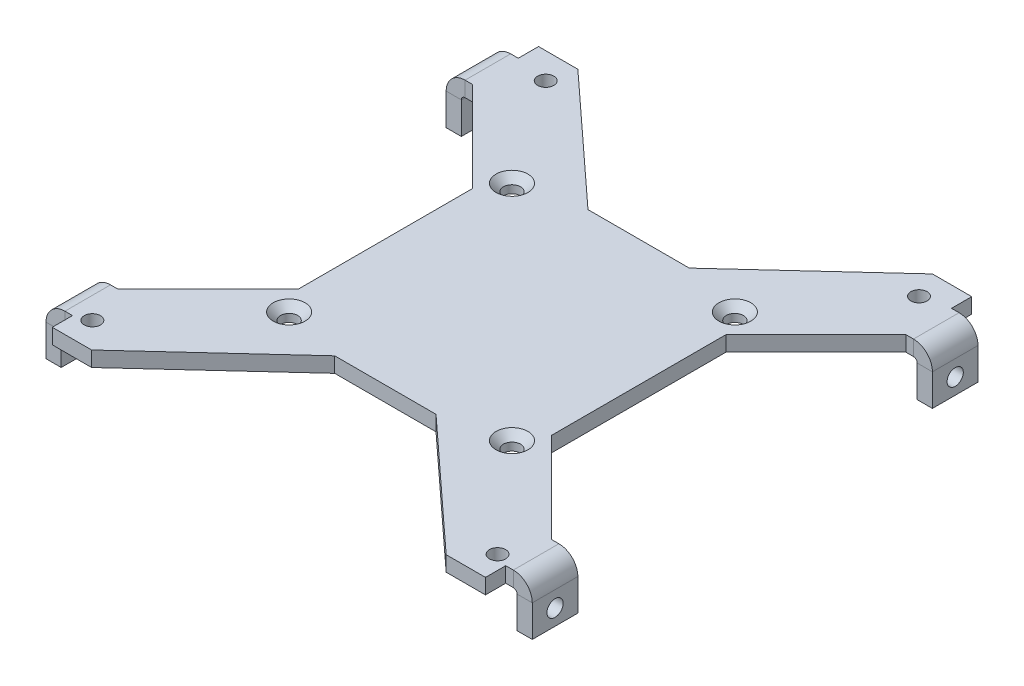
from build123d import *

# Parameters (mm, degrees)
SKETCH1_R                                       = 1.6
BASE_FLANGE1_DEPTH                              = 3
EDGE_FLANGE1_START                              = -44
EDGE_FLANGE1_DEPTH                              = 10.5
EDGE_FLANGE1_START_2                            = 33.5
EDGE_FLANGE1_2_DEPTH                            = 10.5
EDGE_FLANGE1_START_3                            = -35
EDGE_FLANGE1_3_DEPTH                            = 1.5
EDGE_FLANGE1_4_DEPTH                            = 1.5
EDGE_FLANGE1_START_4                            = -45.5
EDGE_FLANGE1_5_OUTLINE_W                        = 1.2366
EDGE_FLANGE1_5_OUTLINE_H                        = 3
EDGE_FLANGE1_5_DEPTH                            = 1.5
EDGE_FLANGE1_START_5                            = 44
EDGE_FLANGE1_6_OUTLINE_W                        = 1.2366
EDGE_FLANGE1_6_OUTLINE_H                        = 3
EDGE_FLANGE1_6_DEPTH                            = 1.5
EDGE_FLANGE1_7_DEPTH                            = 9
EDGE_FLANGE1_START_6                            = 35
EDGE_FLANGE1_8_DEPTH                            = 9
CUT_EXTRUDE2_DEPTH                              = 108.796103826
CUT_EXTRUDE2_DEPTH_BACK                         = 108.796103826
SKETCH27_R                                      = 1.6
SKETCH29_R                                      = 1.6
CUT_EXTRUDE4_DEPTH                              = 69.614867194
SKETCH40_W                                      = 1.2366
SKETCH40_H                                      = 2.5
CUT_EXTRUDE5_DEPTH                              = 69.614867194
CSK_FOR_M3_FLAT_HEAD_MACHINE_SCREW1_D           = 3.4
CSK_FOR_M3_FLAT_HEAD_MACHINE_SCREW1_CSINK_D     = 6.3
CSK_FOR_M3_FLAT_HEAD_MACHINE_SCREW1_CSINK_ANGLE = 90


# Read off the part's stored shape, not the designer's step: Edge-Flange1
# Sheet-metal steps are written as plain solids
with BuildPart() as part:
    # Sketch1 → Base-Flange1 (new body)
    with BuildSketch(Plane(origin=(0, 0, 0), x_dir=(1, 0, 0), z_dir=(0, 1, 0))):
        Polygon((-10, 25), (-35, 48), (-44, 48), (-44, 44), (-48, 44), (-48, 35), (-25, 10), (-25, -10), (-48, -35), (-48, -44), (-44, -44), (-44, -48), (-35, -48), (-10, -25), (10, -25), (35, -48), (44, -48), (44, -44), (48, -44), (48, -35), (25, -10), (25, 10), (48, 35), (48, 44), (44, 44), (44, 48), (35, 48), (10, 25), align=None)
        with Locations(Location((-22.000213283, 22.000213283, 0), (0, 0, 270))):
            Circle(SKETCH1_R, mode=Mode.SUBTRACT)
        with Locations(Location((22.000213283, 22.000213283, 0), (0, 0, 270))):
            Circle(SKETCH1_R, mode=Mode.SUBTRACT)
        with Locations(Location((22.000213283, -22.000213283, 0), (0, 0, 270))):
            Circle(SKETCH1_R, mode=Mode.SUBTRACT)
        with Locations(Location((-22.000213283, -22.000213283, 0), (0, 0, 270))):
            Circle(SKETCH1_R, mode=Mode.SUBTRACT)
    extrude(amount=-BASE_FLANGE1_DEPTH)

    # Edge-Flange1 outline → Edge-Flange1 (cut)
    with BuildSketch(Plane.XY.offset(EDGE_FLANGE1_START)):
        with BuildLine():
            ThreePointArc((-47.926677222, -3), (-46.630867001, -0.845704021), (-44.2634, 0))
            Line((-44.2634, 0), (-48, 0))
            Line((-48, 0), (-48, -3))
            Line((-48, -3), (-47.926677222, -3))
        make_face()
        with BuildLine():
            Line((48, 0), (44.2634, 0))
            ThreePointArc((44.2634, 0), (46.630867001, -0.845704021), (47.926677222, -3))
            Line((47.926677222, -3), (48, -3))
            Line((48, -3), (48, 0))
        make_face()
    extrude(amount=EDGE_FLANGE1_DEPTH, mode=Mode.SUBTRACT)

    # Edge-Flange1 2 outline → Edge-Flange1 2 (cut)
    with BuildSketch(Plane.XY.offset(EDGE_FLANGE1_START_2)):
        with BuildLine():
            ThreePointArc((-47.926677222, -3), (-46.630867001, -0.845704021), (-44.2634, 0))
            Line((-44.2634, 0), (-48, 0))
            Line((-48, 0), (-48, -3))
            Line((-48, -3), (-47.926677222, -3))
        make_face()
        with BuildLine():
            Line((48, 0), (44.2634, 0))
            ThreePointArc((44.2634, 0), (46.630867001, -0.845704021), (47.926677222, -3))
            Line((47.926677222, -3), (48, -3))
            Line((48, -3), (48, 0))
        make_face()
    extrude(amount=EDGE_FLANGE1_2_DEPTH, mode=Mode.SUBTRACT)

    # Edge-Flange1 3 outline → Edge-Flange1 3 (cut)
    with BuildSketch(Plane.XY.offset(EDGE_FLANGE1_START_3)):
        with BuildLine():
            Line((-42.7634, -3), (-42.7634, 0))
            Line((-42.7634, 0), (-44.2634, 0))
            ThreePointArc((-44.2634, 0), (-46.630867001, -0.845704021), (-47.926677222, -3))
            Line((-47.926677222, -3), (-42.7634, -3))
        make_face()
        with BuildLine():
            Line((42.7634, 0), (42.7634, -3))
            Line((42.7634, -3), (47.926677222, -3))
            ThreePointArc((47.926677222, -3), (46.630867001, -0.845704021), (44.2634, 0))
            Line((44.2634, 0), (42.7634, 0))
        make_face()
    extrude(amount=EDGE_FLANGE1_3_DEPTH, mode=Mode.SUBTRACT)

    # Edge-Flange1 4 outline → Edge-Flange1 4 (cut)
    with BuildSketch(Plane.XY.offset(EDGE_FLANGE1_START_2)):
        with BuildLine():
            Line((-42.7634, -3), (-42.7634, 0))
            Line((-42.7634, 0), (-44.2634, 0))
            ThreePointArc((-44.2634, 0), (-46.630867001, -0.845704021), (-47.926677222, -3))
            Line((-47.926677222, -3), (-42.7634, -3))
        make_face()
        with BuildLine():
            Line((42.7634, 0), (42.7634, -3))
            Line((42.7634, -3), (47.926677222, -3))
            ThreePointArc((47.926677222, -3), (46.630867001, -0.845704021), (44.2634, 0))
            Line((44.2634, 0), (42.7634, 0))
        make_face()
    extrude(amount=EDGE_FLANGE1_4_DEPTH, mode=Mode.SUBTRACT)

    # Edge-Flange1 5 outline → Edge-Flange1 5 (cut)
    with BuildSketch(Plane.XY.offset(EDGE_FLANGE1_START_4)):
        with Locations((-43.3817, -1.5)):
            Rectangle(EDGE_FLANGE1_5_OUTLINE_W, EDGE_FLANGE1_5_OUTLINE_H)
        with Locations((43.3817, -1.5)):
            Rectangle(EDGE_FLANGE1_5_OUTLINE_W, EDGE_FLANGE1_5_OUTLINE_H)
    extrude(amount=EDGE_FLANGE1_5_DEPTH, mode=Mode.SUBTRACT)

    # Edge-Flange1 6 outline → Edge-Flange1 6 (cut)
    with BuildSketch(Plane.XY.offset(EDGE_FLANGE1_START_5)):
        with Locations((-43.3817, -1.5)):
            Rectangle(EDGE_FLANGE1_6_OUTLINE_W, EDGE_FLANGE1_6_OUTLINE_H)
        with Locations((43.3817, -1.5)):
            Rectangle(EDGE_FLANGE1_6_OUTLINE_W, EDGE_FLANGE1_6_OUTLINE_H)
    extrude(amount=EDGE_FLANGE1_6_DEPTH, mode=Mode.SUBTRACT)

    # Edge-Flange1 7 outline → Edge-Flange1 7 (add)
    with BuildSketch(Plane.XY.offset(EDGE_FLANGE1_START)):
        with BuildLine():
            ThreePointArc((-45, -3.7366), (-44.784254855, -3.215745145), (-44.2634, -3))
            Line((-44.2634, -3), (-47.926677222, -3))
            ThreePointArc((-47.926677222, -3), (-47.981624121, -3.36647982), (-48, -3.7366))
            Line((-48, -3.7366), (-48, -10))
            Line((-48, -10), (-45, -10))
            Line((-45, -10), (-45, -3.7366))
        make_face()
        with BuildLine():
            Line((47.926677222, -3), (44.2634, -3))
            ThreePointArc((44.2634, -3), (44.784254855, -3.215745145), (45, -3.7366))
            Line((45, -3.7366), (45, -10))
            Line((45, -10), (48, -10))
            Line((48, -10), (48, -3.7366))
            ThreePointArc((48, -3.7366), (47.981624121, -3.36647982), (47.926677222, -3))
        make_face()
    extrude(amount=EDGE_FLANGE1_7_DEPTH)

    # Edge-Flange1 8 outline → Edge-Flange1 8 (add)
    with BuildSketch(Plane.XY.offset(EDGE_FLANGE1_START_6)):
        with BuildLine():
            ThreePointArc((-45, -3.7366), (-44.784254855, -3.215745145), (-44.2634, -3))
            Line((-44.2634, -3), (-47.926677222, -3))
            ThreePointArc((-47.926677222, -3), (-47.981624121, -3.36647982), (-48, -3.7366))
            Line((-48, -3.7366), (-48, -10))
            Line((-48, -10), (-45, -10))
            Line((-45, -10), (-45, -3.7366))
        make_face()
        with BuildLine():
            Line((47.926677222, -3), (44.2634, -3))
            ThreePointArc((44.2634, -3), (44.784254855, -3.215745145), (45, -3.7366))
            Line((45, -3.7366), (45, -10))
            Line((45, -10), (48, -10))
            Line((48, -10), (48, -3.7366))
            ThreePointArc((48, -3.7366), (47.981624121, -3.36647982), (47.926677222, -3))
        make_face()
    extrude(amount=EDGE_FLANGE1_8_DEPTH)

    # Sketch27 → Cut-Extrude2 (cut, two sides: drawn at the far end of the back side and taken through both)
    with BuildSketch(Plane.ZY.offset(48).offset(-CUT_EXTRUDE2_DEPTH_BACK)):
        with Locations(Location((39.5, -6.8683, 0), (0, 0, 270))):
            Circle(SKETCH27_R)
        with Locations(Location((-39.5, -6.8683, 0), (0, 0, 270))):
            Circle(SKETCH27_R)
    extrude(amount=CUT_EXTRUDE2_DEPTH + CUT_EXTRUDE2_DEPTH_BACK, mode=Mode.SUBTRACT)

    # Sketch29 → Cut-Extrude4 (cut, through all)
    with BuildSketch(Plane(origin=(0, 0, 0), x_dir=(1, 0, 0), z_dir=(0, 1, 0))):
        with Locations(Location((-36.2, 42.85, 0), (0, 0, 270))):
            Circle(SKETCH29_R)
        with Locations(Location((37.5, 42.85, 0), (0, 0, 270))):
            Circle(SKETCH29_R)
        with Locations(Location((40, -42.85, 0), (0, 0, 270))):
            Circle(SKETCH29_R)
        with Locations(Location((-40, -42.85, 0), (0, 0, 270))):
            Circle(SKETCH29_R)
    extrude(amount=-CUT_EXTRUDE4_DEPTH, mode=Mode.SUBTRACT)

    # Sketch40 → Cut-Extrude5 (cut, through all)
    with BuildSketch(Plane(origin=(0, 0, 0), x_dir=(1, 0, 0), z_dir=(0, 1, 0))):
        Polygon((-42.7634, 35), (-25, 17.2366), (-25, 10), (-46.62, 33.5), (-42.7634, 33.5), align=None)
        with Locations((-43.3817, 46.75)):
            Rectangle(SKETCH40_W, SKETCH40_H)
        Polygon((42.7634, 33.5), (42.7634, 35), (25, 17.2366), (25, 10), (46.62, 33.5), align=None)
        with Locations((43.3817, 46.75)):
            Rectangle(SKETCH40_W, SKETCH40_H)
        Polygon((42.7634, -35), (25, -17.2366), (25, -10), (46.62, -33.5), (42.7634, -33.5), align=None)
        with Locations((43.3817, -46.75)):
            Rectangle(SKETCH40_W, SKETCH40_H)
        Polygon((-42.7634, -33.5), (-42.7634, -35), (-25, -17.2366), (-25, -10), (-46.62, -33.5), align=None)
        with Locations((-43.3817, -46.75)):
            Rectangle(SKETCH40_W, SKETCH40_H)
    extrude(amount=-CUT_EXTRUDE5_DEPTH, mode=Mode.SUBTRACT)

    # CSK for M3 Flat Head Machine Screw1 (through all)
    with Locations(Plane(origin=(0, 0, 0), x_dir=(1, 0, 0), z_dir=(0, 1, 0))):
        with Locations((-22.000213283, 22.000213283), (22.000213283, 22.000213283), (22.000213283, -22.000213283), (-22.000213283, -22.000213283)):
            CounterSinkHole(CSK_FOR_M3_FLAT_HEAD_MACHINE_SCREW1_D / 2, CSK_FOR_M3_FLAT_HEAD_MACHINE_SCREW1_CSINK_D / 2, counter_sink_angle=CSK_FOR_M3_FLAT_HEAD_MACHINE_SCREW1_CSINK_ANGLE)


solid = part.part
